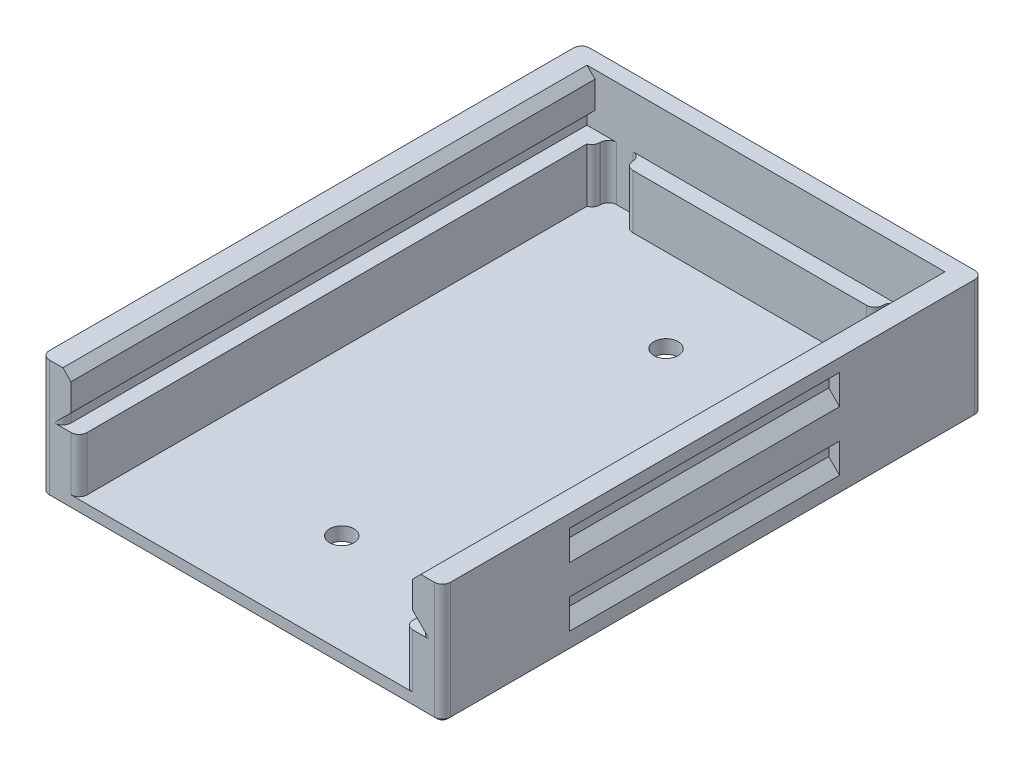
from build123d import *

# Parameters (mm, degrees)
SKETCH1_W           = 66.25
SKETCH1_H           = 97
BOSS_EXTRUDE1_DEPTH = 2.5
BOSS_EXTRUDE2_DEPTH = 97
SKETCH3_W           = 1
SKETCH3_H           = 3
BOSS_EXTRUDE3_DEPTH = 10
SKETCH4_W           = 74.25
SKETCH4_H           = 3
BOSS_EXTRUDE4_DEPTH = 22.12
SKETCH6_R           = 2.25
CUT_EXTRUDE1_DEPTH  = 67.448927945
FILLET1_R           = 1.5
CUT_EXTRUDE2_DEPTH  = 25
CHAMFER1_SIZE       = 0.5


with BuildPart() as part:
    # Sketch1 → Boss-Extrude1 (new body)
    with BuildSketch(Plane(origin=(0, 0, 0), x_dir=(1, 0, 0), z_dir=(0, 1, 0))):
        Rectangle(SKETCH1_W, SKETCH1_H)
    extrude(amount=BOSS_EXTRUDE1_DEPTH)

    # Sketch2 → Boss-Extrude2 (add)
    with BuildSketch(Plane.XY.offset(48.5)):
        Polygon((30.125, 2.5), (30.125, 12.5), (33.125, 12.5), (33.125, 14.12), (31.625, 15.62), (31.625, 20.62), (33.125, 22.12), (37.125, 22.12), (37.125, 0), (30.125, 0), align=None)
        Polygon((-31.625, 20.62), (-33.125, 22.12), (-37.125, 22.12), (-37.125, 0), (-30.125, 0), (-30.125, 2.5), (-30.125, 12.5), (-33.125, 12.5), (-33.125, 14.12), (-31.625, 15.62), align=None)
    extrude(amount=-BOSS_EXTRUDE2_DEPTH)

    # Sketch3 → Boss-Extrude3 (add)
    with BuildSketch(Plane(origin=(0, 2.5, 0), x_dir=(1, 0, 0), z_dir=(0, 1, 0))):
        Polygon((-23.125, 48.5), (-23.125, 45.5), (23.125, 45.5), (23.125, 48.5), (0, 48.5), align=None)
        with Locations((29.625, 47)):
            Rectangle(SKETCH3_W, SKETCH3_H)
        with Locations((-29.625, 47)):
            Rectangle(SKETCH3_W, SKETCH3_H)
    extrude(amount=BOSS_EXTRUDE3_DEPTH)

    # Sketch4 → Boss-Extrude4 (add)
    with BuildSketch(Plane.XZ):
        with Locations((0, -50)):
            Rectangle(SKETCH4_W, SKETCH4_H)
    extrude(amount=-BOSS_EXTRUDE4_DEPTH)

    # Sketch6 → Cut-Extrude1 (cut, through all)
    with BuildSketch(Plane(origin=(0, 2.5, 0), x_dir=(1, 0, 0), z_dir=(0, 1, 0))):
        with Locations(Location((0, 30, 0), (0, 0, 270))):
            Circle(SKETCH6_R)
        with Locations(Location((0, -30, 0), (0, 0, 270))):
            Circle(SKETCH6_R)
    extrude(amount=-CUT_EXTRUDE1_DEPTH, mode=Mode.SUBTRACT)

    # Fillet1
    # the kernel refuses this fillet: 1.5 mm, written as the material it adds along each edge
    with BuildSketch(Plane(origin=(29.125, 2.5, -48.5), x_dir=(-1, 0, 0), z_dir=(0, 1, 0)), Plane(origin=(-23.125, 2.5, -48.5), x_dir=(-1, 0, 0), z_dir=(0, 1, 0))) as fillet1_piece_1:
        with BuildLine():
            CenterArc((FILLET1_R, FILLET1_R), FILLET1_R, 180, 90)
            Line((0, FILLET1_R), (0, 0))
            Line((0, 0), (FILLET1_R, 0))
        make_face()
    extrude(amount=10)
    with BuildSketch(Plane(origin=(23.125, 2.5, -48.5), x_dir=(1, 0, 0), z_dir=(0, 1, 0)), Plane(origin=(-29.125, 2.5, -48.5), x_dir=(1, 0, 0), z_dir=(0, 1, 0))) as fillet1_piece_2:
        with BuildLine():
            CenterArc((FILLET1_R, -FILLET1_R), FILLET1_R, 90, 90)
            Line((0, -FILLET1_R), (0, 0))
            Line((0, 0), (FILLET1_R, 0))
        make_face()
    extrude(amount=10)
    # the kernel refuses this fillet: 1.5 mm, written as the material it takes off along each edge
    with BuildSketch(Plane(origin=(-33.125, 12.5, 48.5), x_dir=(-1, 0, 0), z_dir=(0, 1, 0))) as fillet1_2_piece_1_section:
        with BuildLine():
            CenterArc((FILLET1_R, -FILLET1_R), FILLET1_R, 90, 90)
            Line((0, -FILLET1_R), (0, 0))
            Line((0, 0), (FILLET1_R, 0))
        make_face()
    fillet1_2_piece_1 = extrude(amount=5.37, mode=Mode.PRIVATE)
    fillet1_2_piece_1 = split(fillet1_2_piece_1, bisect_by=Plane(origin=(-33.935, 13.31, 48.5), z_dir=(0.7071067811865467, -0.7071067811865483, 0)), keep=Keep.TOP, mode=Mode.PRIVATE)
    add(fillet1_2_piece_1, mode=Mode.SUBTRACT)
    with BuildSketch(Plane(origin=(33.125, 12.5, 48.5), x_dir=(1, 0, 0), z_dir=(0, 1, 0))) as fillet1_2_piece_2_section:
        with BuildLine():
            CenterArc((FILLET1_R, FILLET1_R), FILLET1_R, 180, 90)
            Line((0, FILLET1_R), (0, 0))
            Line((0, 0), (FILLET1_R, 0))
        make_face()
    fillet1_2_piece_2 = extrude(amount=5.37, mode=Mode.PRIVATE)
    fillet1_2_piece_2 = split(fillet1_2_piece_2, bisect_by=Plane(origin=(33.935, 13.31, 48.5), z_dir=(-0.7071067811865438, -0.7071067811865512, 0)), keep=Keep.TOP, mode=Mode.PRIVATE)
    add(fillet1_2_piece_2, mode=Mode.SUBTRACT)
    with BuildSketch(Plane(origin=(-30.125, 16.25, 48.5), x_dir=(-1, 0, 0), z_dir=(0, -1, 0)), Plane(origin=(30.125, 2.5, 48.5), x_dir=(1, 0, 0), z_dir=(0, 1, 0)), Plane(origin=(-23.125, 2.5, -45.5), x_dir=(1, 0, 0), z_dir=(0, 1, 0)), Plane(origin=(23.125, 2.5, -45.5), x_dir=(0, 0, -1), z_dir=(0, 1, 0))) as fillet1_2_piece_3:
        with BuildLine():
            CenterArc((FILLET1_R, FILLET1_R), FILLET1_R, 180, 90)
            Line((0, FILLET1_R), (0, 0))
            Line((0, 0), (FILLET1_R, 0))
        make_face()
    extrude(amount=13.75, mode=Mode.SUBTRACT)
    with BuildSketch(Plane(origin=(29.125, 2.5, -45.5), x_dir=(0, 0, -1), z_dir=(0, 1, 0))) as fillet1_2_piece_4:
        with BuildLine():
            CenterArc((1.414213562, -1.5), FILLET1_R, 90, 70.528779366)
            Line((0, -1), (0, 0))
            Line((0, 0), (1.414213562, 0))
        make_face()
    extrude(amount=13.535533906, mode=Mode.SUBTRACT)
    with BuildSketch(Plane(origin=(-29.125, 2.5, -45.5), x_dir=(0, 0, -1), z_dir=(0, 1, 0))) as fillet1_2_piece_5:
        with BuildLine():
            CenterArc((1.414213562, 1.5), FILLET1_R, 199.471220634, 70.528779366)
            Line((0, 1), (0, 0))
            Line((0, 0), (1.414213562, 0))
        make_face()
    extrude(amount=13.535533906, mode=Mode.SUBTRACT)
    with BuildSketch(Plane(origin=(37.125, 25.87, 48.5), x_dir=(-1, 0, 0), z_dir=(0, -1, 0)), Plane(origin=(-37.125, 25.87, 48.5), x_dir=(0, 0, -1), z_dir=(0, -1, 0)), Plane(origin=(-37.125, -3.75, -51.5), x_dir=(0, 0, 1), z_dir=(0, 1, 0))) as fillet1_2_piece_6:
        with BuildLine():
            CenterArc((FILLET1_R, FILLET1_R), FILLET1_R, 180, 90)
            Line((0, FILLET1_R), (0, 0))
            Line((0, 0), (FILLET1_R, 0))
        make_face()
    extrude(amount=29.62, mode=Mode.SUBTRACT)
    with BuildSketch(Plane(origin=(37.125, -3.75, -51.5), x_dir=(0, 0, 1), z_dir=(0, 1, 0))) as fillet1_2_piece_7:
        with BuildLine():
            CenterArc((FILLET1_R, -FILLET1_R), FILLET1_R, 90, 90)
            Line((0, -FILLET1_R), (0, 0))
            Line((0, 0), (FILLET1_R, 0))
        make_face()
    extrude(amount=29.62, mode=Mode.SUBTRACT)

    # Sketch7 → Cut-Extrude2 (cut, symmetric)
    with BuildSketch(Plane.XY):
        Polygon((-37.125, 8.75), (-35.125, 6.75), (-35.125, 5.25), (-37.125, 3.25), align=None)
        Polygon((-37.125, 19.75), (-35.125, 17.75), (-35.125, 16.25), (-37.125, 14.25), align=None)
        Polygon((37.125, 19.75), (37.125, 14.25), (35.125, 16.25), (35.125, 17.75), align=None)
        Polygon((37.125, 8.75), (37.125, 3.25), (35.125, 5.25), (35.125, 6.75), align=None)
    extrude(amount=CUT_EXTRUDE2_DEPTH, both=True, mode=Mode.SUBTRACT)

    # Chamfer1
    chamfer1_edges = [part.edges().sort_by_distance(p)[0] for p in [
        (0, 0, 48.5),
        (37.125, 0, -1.5),
        (-37.125, 0, -1.5),
        (0, 0, -51.5),
        (36.685660172, 0, -51.060660172),
        (-36.685660172, 0, -51.060660172),
        (-36.685660172, 0, 48.060660172),
        (36.685660172, 0, 48.060660172),
    ]]
    chamfer(chamfer1_edges, length=CHAMFER1_SIZE)


solid = part.part
